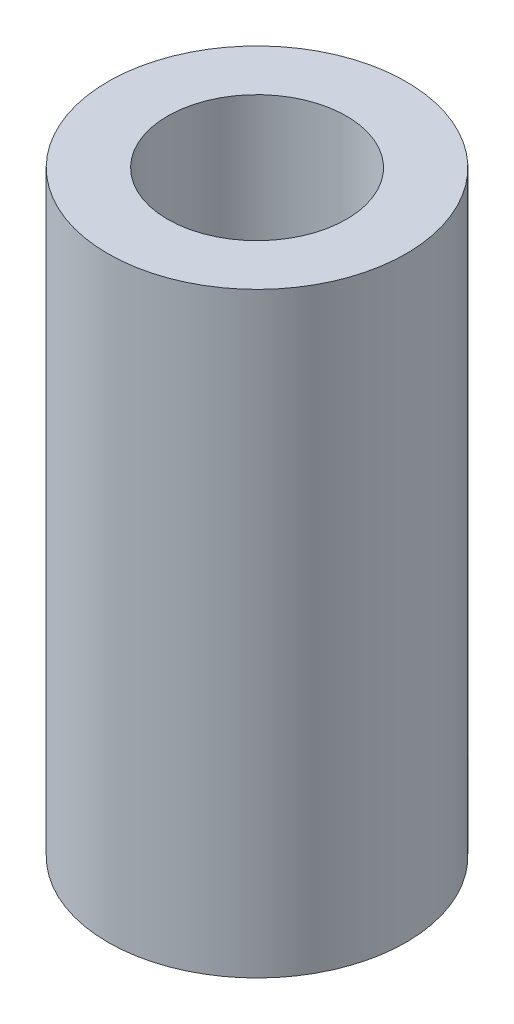
from build123d import *

# Parameters (mm, degrees)
SKETCH1_R           = 2.5
SKETCH1_R_2         = 1.5
BOSS_EXTRUDE1_DEPTH = 10


with BuildPart() as part:
    # Sketch1 → Boss-Extrude1 (new body)
    with BuildSketch(Plane(origin=(0, 0, 0), x_dir=(1, 0, 0), z_dir=(0, 1, 0))):
        Circle(SKETCH1_R)
        Circle(SKETCH1_R_2, mode=Mode.SUBTRACT)
    extrude(amount=BOSS_EXTRUDE1_DEPTH)


solid = part.part
